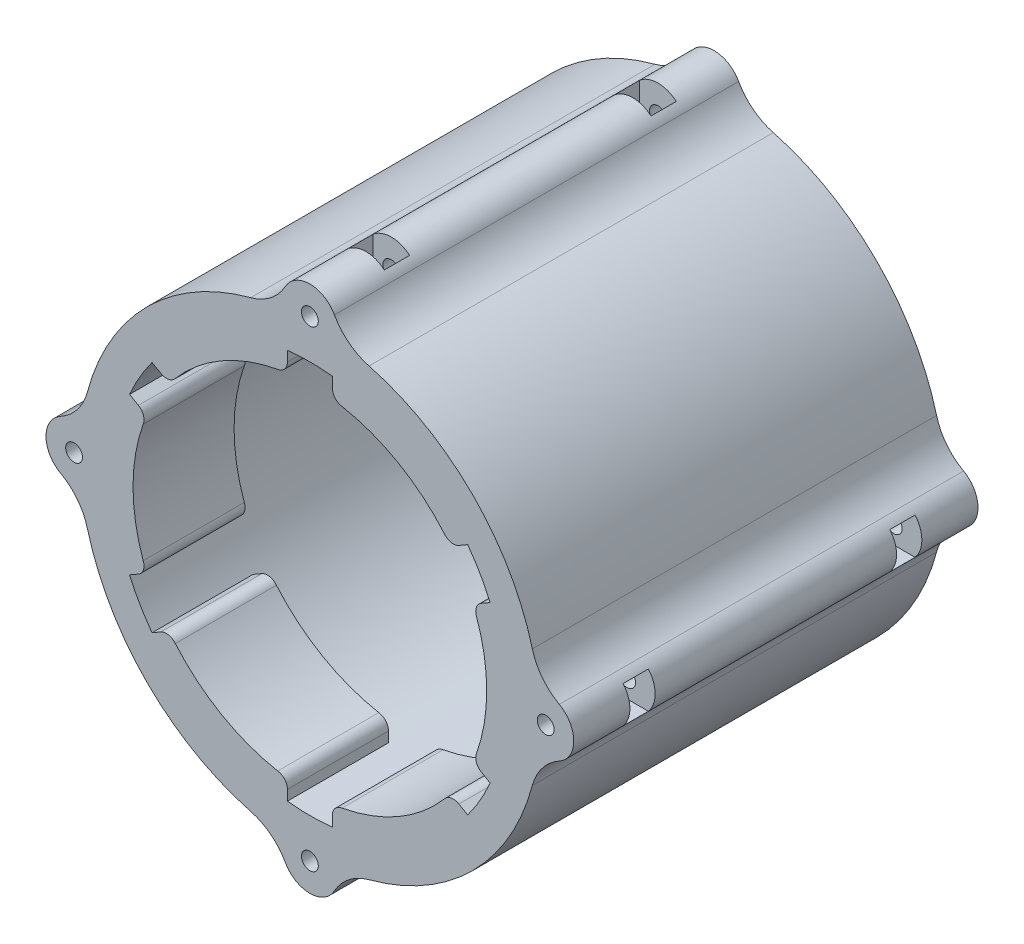
from build123d import *

# Parameters (mm, degrees)
IZIM1_R                     = 35
IZIM1_R_2                   = 1.5
Y_KSEKLIK_EKSTR_ZYON1_DEPTH = 72
Y_KSEKLIK_EKSTR_ZYON2_START = -18
Y_KSEKLIK_EKSTR_ZYON2_DEPTH = 18
KES_EKSTR_ZYON1_DEPTH       = 4.5
DAIRESEL_KAPLAMA1_COUNT     = 4
AYNALAMA1_COPY_1_DEPTH      = 4.5
AYNALAMA1_COPY_2_DEPTH      = 4.5
AYNALAMA1_COPY_3_DEPTH      = 4.5
AYNALAMA1_COPY_4_DEPTH      = 4.5


with BuildPart() as part:
    # Çizim1 → Yükseklik-Ekstrüzyon1 (new body)
    with BuildSketch(Plane.XY):
        with BuildLine():
            ThreePointArc((-39.621848739, -10.540830255), (-28.991378029, -28.991378029), (-10.540830255, -39.621848739))
            ThreePointArc((-10.540830255, -39.621848739), (-6.966269622, -41.396931543), (-4.370588155, -44.428571429))
            ThreePointArc((-4.370588155, -44.428571429), (0, -47), (4.370588155, -44.428571429))
            ThreePointArc((4.370588155, -44.428571429), (6.966269622, -41.396931543), (10.540830255, -39.621848739))
            ThreePointArc((10.540830255, -39.621848739), (28.991378029, -28.991378029), (39.621848739, -10.540830255))
            ThreePointArc((39.621848739, -10.540830255), (41.396931543, -6.966269622), (44.428571429, -4.370588155))
            ThreePointArc((44.428571429, -4.370588155), (47, 0), (44.428571429, 4.370588155))
            ThreePointArc((44.428571429, 4.370588155), (41.396931543, 6.966269622), (39.621848739, 10.540830255))
            ThreePointArc((39.621848739, 10.540830255), (28.991378029, 28.991378029), (10.540830255, 39.621848739))
            ThreePointArc((10.540830255, 39.621848739), (6.966269622, 41.396931543), (4.370588155, 44.428571429))
            ThreePointArc((4.370588155, 44.428571429), (0, 47), (-4.370588155, 44.428571429))
            ThreePointArc((-4.370588155, 44.428571429), (-6.966269622, 41.396931543), (-10.540830255, 39.621848739))
            ThreePointArc((-10.540830255, 39.621848739), (-28.991378029, 28.991378029), (-39.621848739, 10.540830255))
            ThreePointArc((-39.621848739, 10.540830255), (-41.396931543, 6.966269622), (-44.428571429, 4.370588155))
            ThreePointArc((-44.428571429, 4.370588155), (-47, 0), (-44.428571429, -4.370588155))
            ThreePointArc((-44.428571429, -4.370588155), (-41.396931543, -6.966269622), (-39.621848739, -10.540830255))
        make_face()
        Circle(IZIM1_R, mode=Mode.SUBTRACT)
        with Locations((-42, 0)):
            Circle(IZIM1_R_2, mode=Mode.SUBTRACT)
        with Locations((0, 42)):
            Circle(IZIM1_R_2, mode=Mode.SUBTRACT)
        with Locations((42, 0)):
            Circle(IZIM1_R_2, mode=Mode.SUBTRACT)
        with Locations((0, -42)):
            Circle(IZIM1_R_2, mode=Mode.SUBTRACT)
    extrude(amount=Y_KSEKLIK_EKSTR_ZYON1_DEPTH)

    # Çizim2 → Yükseklik-Ekstrüzyon2 (add)
    with BuildSketch(Plane.XY.offset(72).offset(Y_KSEKLIK_EKSTR_ZYON2_START)):
        with BuildLine():
            Line((-4, 34.770677301), (-4, 32.956280932))
            ThreePointArc((-4, 32.956280932), (-4.492443277, 31.64202345), (-5.727272727, 30.97496323))
            ThreePointArc((-5.727272727, 30.97496323), (-15.75, 27.279800219), (-23.961468675, 20.447445291))
            ThreePointArc((-23.961468675, 20.447445291), (-25.156574497, 19.711581728), (-26.540976501, 19.942242081))
            Line((-26.540976501, 19.942242081), (-28.11228985, 20.849440266))
            ThreePointArc((-28.11228985, 20.849440266), (-17.5, 30.310889132), (-4, 34.770677301))
        make_face()
        with BuildLine():
            Line((4, 34.770677301), (4, 32.956280932))
            ThreePointArc((4, 32.956280932), (4.492443277, 31.64202345), (5.727272727, 30.97496323))
            ThreePointArc((5.727272727, 30.97496323), (15.75, 27.279800219), (23.961468675, 20.447445291))
            ThreePointArc((23.961468675, 20.447445291), (25.156574497, 19.711581728), (26.540976501, 19.942242081))
            Line((26.540976501, 19.942242081), (28.11228985, 20.849440266))
            ThreePointArc((28.11228985, 20.849440266), (17.5, 30.310889132), (4, 34.770677301))
        make_face()
        with BuildLine():
            Line((32.11228985, 13.921237036), (30.540976501, 13.014038851))
            ThreePointArc((30.540976501, 13.014038851), (29.649017774, 11.930441722), (29.688741402, 10.527517939))
            ThreePointArc((29.688741402, 10.527517939), (31.5, 0), (29.688741402, -10.527517939))
            ThreePointArc((29.688741402, -10.527517939), (29.649017774, -11.930441722), (30.540976501, -13.014038851))
            Line((30.540976501, -13.014038851), (32.11228985, -13.921237036))
            ThreePointArc((32.11228985, -13.921237036), (35, 0), (32.11228985, 13.921237036))
        make_face()
        with BuildLine():
            Line((28.11228985, -20.849440266), (26.540976501, -19.942242081))
            ThreePointArc((26.540976501, -19.942242081), (25.156574497, -19.711581728), (23.961468675, -20.447445291))
            ThreePointArc((23.961468675, -20.447445291), (15.75, -27.279800219), (5.727272727, -30.97496323))
            ThreePointArc((5.727272727, -30.97496323), (4.492443277, -31.64202345), (4, -32.956280932))
            Line((4, -32.956280932), (4, -34.770677301))
            ThreePointArc((4, -34.770677301), (17.5, -30.310889132), (28.11228985, -20.849440266))
        make_face()
        with BuildLine():
            Line((-4, -34.770677301), (-4, -32.956280932))
            ThreePointArc((-4, -32.956280932), (-4.492443277, -31.64202345), (-5.727272727, -30.97496323))
            ThreePointArc((-5.727272727, -30.97496323), (-15.75, -27.279800219), (-23.961468675, -20.447445291))
            ThreePointArc((-23.961468675, -20.447445291), (-25.156574497, -19.711581728), (-26.540976501, -19.942242081))
            Line((-26.540976501, -19.942242081), (-28.11228985, -20.849440266))
            ThreePointArc((-28.11228985, -20.849440266), (-17.5, -30.310889132), (-4, -34.770677301))
        make_face()
        with BuildLine():
            Line((-32.11228985, -13.921237036), (-30.540976501, -13.014038851))
            ThreePointArc((-30.540976501, -13.014038851), (-29.649017774, -11.930441722), (-29.688741402, -10.527517939))
            ThreePointArc((-29.688741402, -10.527517939), (-31.5, 0), (-29.688741402, 10.527517939))
            ThreePointArc((-29.688741402, 10.527517939), (-29.649017774, 11.930441722), (-30.540976501, 13.014038851))
            Line((-30.540976501, 13.014038851), (-32.11228985, 13.921237036))
            ThreePointArc((-32.11228985, 13.921237036), (-35, 0), (-32.11228985, -13.921237036))
        make_face()
    extrude(amount=Y_KSEKLIK_EKSTR_ZYON2_DEPTH)

    # Çizim3 → Kes-Ekstrüzyon1 (cut)
    with BuildSketch(Plane(origin=(0, 0, 10), x_dir=(-1, 0, 0), z_dir=(0, 0, -1))):
        Polygon((-3.262029021, -42), (-3.262029021, -48), (3.262029021, -48), (3.262029021, -42), (1.63101451, -39.175), (-1.63101451, -39.175), align=None)
    kes_ekstr_zyon1 = extrude(amount=-KES_EKSTR_ZYON1_DEPTH, mode=Mode.SUBTRACT)

    # Dairesel Kaplama1: Kes-Ekstrüzyon1 ×4 about axis
    dairesel_kaplama1_axis = Axis((0, 0, 0), (0, 0, 1))
    for i in range(1, DAIRESEL_KAPLAMA1_COUNT):
        add(kes_ekstr_zyon1.rotate(dairesel_kaplama1_axis, i * 360 / DAIRESEL_KAPLAMA1_COUNT), mode=Mode.SUBTRACT)

    # Aynalama1 copy 1 sketch → Aynalama1 copy 1 (cut)
    with BuildSketch(Plane(origin=(0, 0, 62), x_dir=(0, -1, 0), z_dir=(0, 0, 1))):
        Polygon((-3.262029021, 42), (-3.262029021, 48), (3.262029021, 48), (3.262029021, 42), (1.63101451, 39.175), (-1.63101451, 39.175), align=None)
    extrude(amount=-AYNALAMA1_COPY_1_DEPTH, mode=Mode.SUBTRACT)

    # Aynalama1 copy 2 sketch → Aynalama1 copy 2 (cut)
    with BuildSketch(Plane.XY.offset(62)):
        Polygon((-3.262029021, 42), (-3.262029021, 48), (3.262029021, 48), (3.262029021, 42), (1.63101451, 39.175), (-1.63101451, 39.175), align=None)
    extrude(amount=-AYNALAMA1_COPY_2_DEPTH, mode=Mode.SUBTRACT)

    # Aynalama1 copy 3 sketch → Aynalama1 copy 3 (cut)
    with BuildSketch(Plane(origin=(0, 0, 62), x_dir=(0, 1, 0), z_dir=(0, 0, 1))):
        Polygon((-3.262029021, 42), (-3.262029021, 48), (3.262029021, 48), (3.262029021, 42), (1.63101451, 39.175), (-1.63101451, 39.175), align=None)
    extrude(amount=-AYNALAMA1_COPY_3_DEPTH, mode=Mode.SUBTRACT)

    # Aynalama1 copy 4 sketch → Aynalama1 copy 4 (cut)
    with BuildSketch(Plane(origin=(0, 0, 62), x_dir=(-1, 0, 0), z_dir=(0, 0, 1))):
        Polygon((-3.262029021, 42), (-3.262029021, 48), (3.262029021, 48), (3.262029021, 42), (1.63101451, 39.175), (-1.63101451, 39.175), align=None)
    extrude(amount=-AYNALAMA1_COPY_4_DEPTH, mode=Mode.SUBTRACT)


solid = part.part
